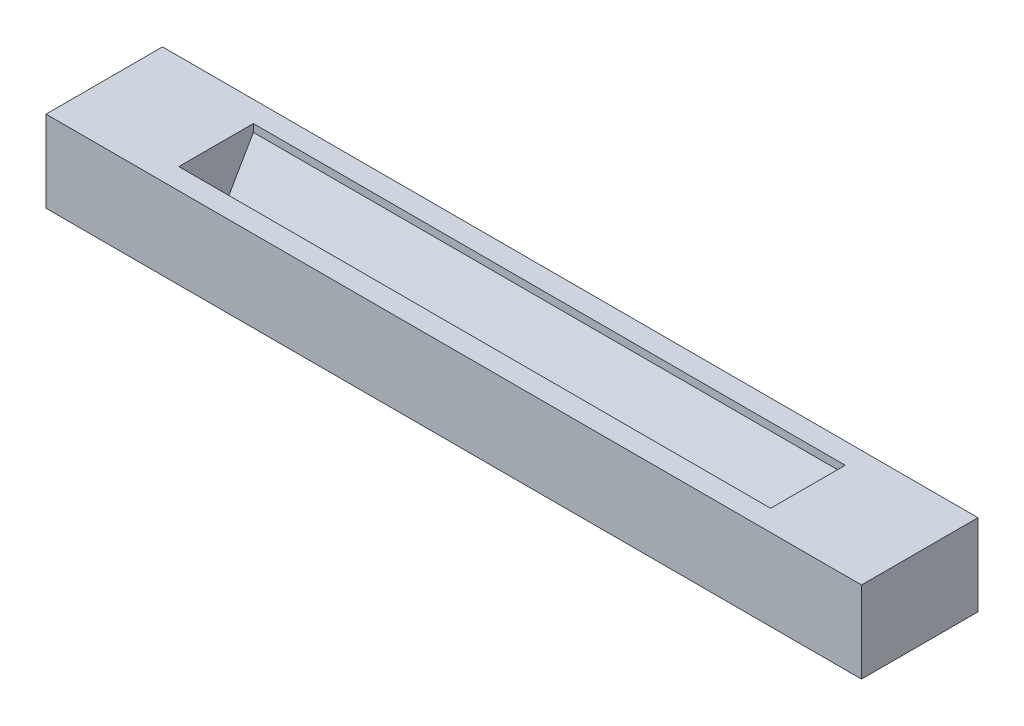
from build123d import *

# Parameters (mm, degrees)
TOP_SKETCH_W                 = 35
TOP_SKETCH_H                 = 5
THICKNESS_EXTRUDE_DEPTH      = 3.5
HANDLE_SKETCH_W              = 25.4
HANDLE_SKETCH_H              = 3.2
HANDLE_SLOT_CUT_DEPTH        = 3.1
HANDLE_SLOT_CHAMFER_1_SIZE   = 1.6
HANDLE_SLOT_CHAMFER_1_SIZE2  = 2.771281292
HANDLE_SLOT_CHAMFER_2_SIZE   = 1.6
HANDLE_SLOT_CHAMFER_2_SIZE_2 = 2.771281292


with BuildPart() as part:
    # Top Sketch → Thickness Extrude (new body)
    with BuildSketch(Plane(origin=(0, 0, 0), x_dir=(1, 0, 0), z_dir=(0, 1, 0))):
        with Locations((-17.5, -0.5)):
            Rectangle(TOP_SKETCH_W, TOP_SKETCH_H)
    extrude(amount=THICKNESS_EXTRUDE_DEPTH)

    # Handle Sketch → Handle Slot Cut (cut)
    with BuildSketch(Plane(origin=(0, 3.5, 0), x_dir=(1, 0, 0), z_dir=(0, 1, 0))):
        with Locations((-17.5, -0.5)):
            Rectangle(HANDLE_SKETCH_W, HANDLE_SKETCH_H)
    extrude(amount=-HANDLE_SLOT_CUT_DEPTH, mode=Mode.SUBTRACT)

    # Handle Slot Chamfer 1
    handle_slot_chamfer_1_edges = [part.edges().sort_by_distance(p)[0] for p in [
        (-17.5, 0.4, 2.1),
    ]]
    handle_slot_chamfer_1_side = [part.faces().sort_by_distance(p)[0] for p in [
        (-17.5, 0.4, 0.5),
    ]]
    chamfer(handle_slot_chamfer_1_edges, length=HANDLE_SLOT_CHAMFER_1_SIZE, length2=HANDLE_SLOT_CHAMFER_1_SIZE2, reference=handle_slot_chamfer_1_side[0])

    # Handle Slot Chamfer 2
    # the kernel refuses this chamfer: 2.771281292, 1.6 mm, written as the material it adds along each edge
    with BuildSketch(Plane(origin=(-37.369542353, 0.4, -1.1), x_dir=(0, -0.057893862402671414, 0.9983227437537925), z_dir=(1, 0, 0))) as handle_slot_chamfer_2_piece_1_section:
        Polygon((HANDLE_SLOT_CHAMFER_2_SIZE * 0.998322743754, -HANDLE_SLOT_CHAMFER_2_SIZE * 0.0578938624027), (-HANDLE_SLOT_CHAMFER_2_SIZE_2 * 0.057893862405, -HANDLE_SLOT_CHAMFER_2_SIZE_2 * 0.998322743793), (0, 0), align=None)
    handle_slot_chamfer_2_piece_1 = extrude(amount=39.739084706, mode=Mode.PRIVATE)
    handle_slot_chamfer_2_piece_1 = split(handle_slot_chamfer_2_piece_1, bisect_by=Plane(origin=(-35, 1.323760431, -0.566666667), z_dir=(1, 0, 0)), keep=Keep.TOP, mode=Mode.PRIVATE)
    handle_slot_chamfer_2_piece_1 = split(handle_slot_chamfer_2_piece_1, bisect_by=Plane(origin=(0, 1.323760431, -0.566666667), z_dir=(-1, 0, 0)), keep=Keep.TOP, mode=Mode.PRIVATE)
    add(handle_slot_chamfer_2_piece_1)


solid = part.part
